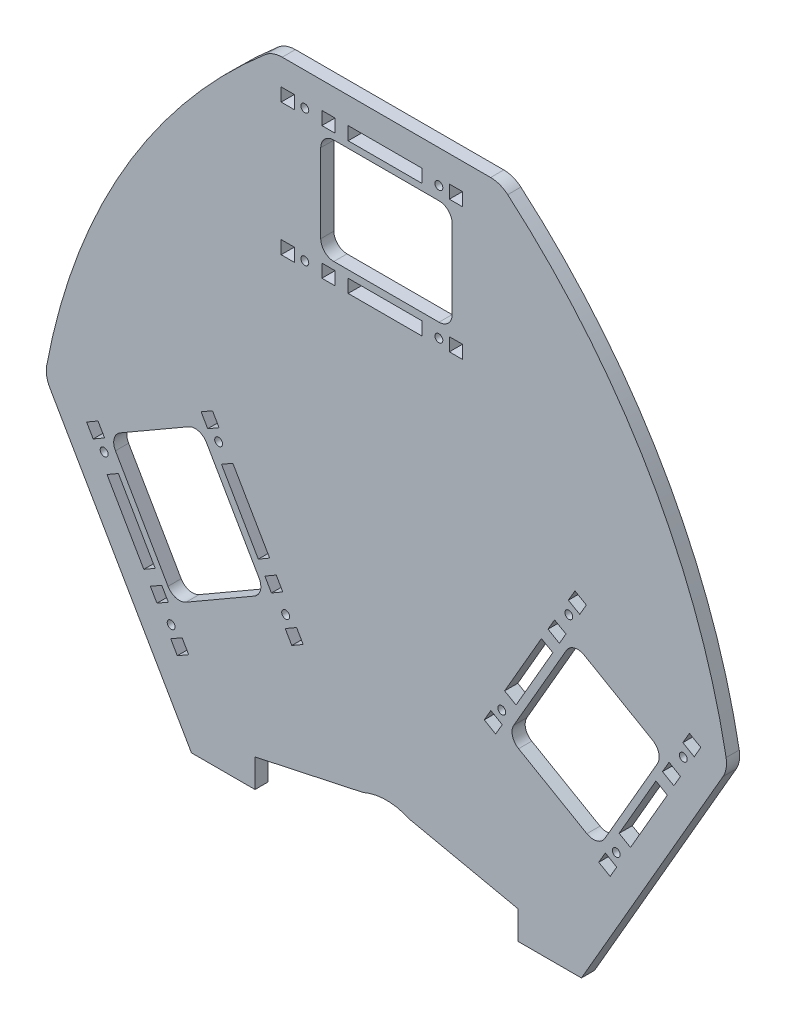
from build123d import *

# Parameters (mm, degrees)
BOSS_EXTRUDE1_DEPTH      = 5
BOSS_EXTRUDE3_DEPTH      = 5
SKETCH2_R                = 1.5
SKETCH2_W                = 50
SKETCH2_H                = 40
SKETCH2_W_2              = 5
SKETCH2_H_2              = 5
SKETCH2_W_3              = 28
CUT_EXTRUDE5_DEPTH       = 10
FILLET1_R                = 5
CIRPATTERN1_COUNT        = 3
FILLET1_OF_CIRPATTERN1_R = 5
FILLET2_R                = 10
BOSS_EXTRUDE4_DEPTH      = 5


with BuildPart() as part:
    # Sketch1 → Boss-Extrude1 (new body)
    with BuildSketch(Plane(origin=(0, 0, 0), x_dir=(0.8660254037844434, -0.49999999999999206, 0), z_dir=(0, 0, 1))):
        Polygon((125, -43.301270189), (125, 43.301270189), (-25, 129.903810568), (-100, 86.602540378), (-100, -86.602540378), (-25, -129.903810568), align=None)
    extrude(amount=BOSS_EXTRUDE1_DEPTH)

    # Sketch5 → Boss-Extrude3 (add)
    with BuildSketch(Plane.XY.offset(5)):
        with BuildLine():
            ThreePointArc((-43.301270189, 125), (-100.007931209, 57.739606004), (-129.903810568, -25))
            Line((-129.903810568, -25), (-43.301270189, 125))
        make_face()
        with BuildLine():
            ThreePointArc((129.903810568, -25), (100.007931209, 57.739606004), (43.301270189, 125))
            Line((43.301270189, 125), (129.903810568, -25))
        make_face()
    extrude(amount=-BOSS_EXTRUDE3_DEPTH)

    # Sketch2 → Cut-Extrude5 (cut)
    with BuildSketch(Plane.XY.offset(5)):
        with Locations((-31.05, 112.5)):
            Circle(SKETCH2_R)
        with Locations((-31.05, 62.1999492)):
            Circle(SKETCH2_R)
        with Locations((19.95, 112.5)):
            Circle(SKETCH2_R)
        with Locations((19.95, 62.1999492)):
            Circle(SKETCH2_R)
        with Locations((0, 87.5)):
            Rectangle(SKETCH2_W, SKETCH2_H)
        with Locations((-37.55, 112.5)):
            Rectangle(SKETCH2_W_2, SKETCH2_H_2)
        with Locations((-22.05, 112.5)):
            Rectangle(SKETCH2_W_2, SKETCH2_H_2)
        with Locations((-0.55, 112.5)):
            Rectangle(SKETCH2_W_3, SKETCH2_H_2)
        with Locations((-37.55, 62.1999492)):
            Rectangle(SKETCH2_W_2, SKETCH2_H_2)
        with Locations((-22.05, 62.1999492)):
            Rectangle(SKETCH2_W_2, SKETCH2_H_2)
        with Locations((-0.55, 62.1999492)):
            Rectangle(SKETCH2_W_3, SKETCH2_H_2)
        with Locations((26.45, 112.5)):
            Rectangle(SKETCH2_W_2, SKETCH2_H_2)
        with Locations((26.45, 62.1999492)):
            Rectangle(SKETCH2_W_2, SKETCH2_H_2)
    cut_extrude5 = extrude(amount=-CUT_EXTRUDE5_DEPTH, mode=Mode.SUBTRACT)

    # Fillet1
    fillet1_edges = [part.edges().sort_by_distance(p)[0] for p in [
        (25, 107.5, 2.5),
        (25, 67.5, 2.5),
        (-25, 67.5, 2.5),
        (-25, 107.5, 2.5),
    ]]
    fillet(fillet1_edges, radius=FILLET1_R)

    # CirPattern1: Cut-Extrude5 ×3 about axis
    cirpattern1_axis = Axis((0, 0, 0), (0, 0, -1))
    for i in range(1, CIRPATTERN1_COUNT):
        add(cut_extrude5.rotate(cirpattern1_axis, i * 360 / CIRPATTERN1_COUNT), mode=Mode.SUBTRACT)

    # Fillet1 of CirPattern1
    fillet1_of_cirpattern1_edges = [part.edges().sort_by_distance(p)[0] for p in [
        (80.597730907, -75.400635095, 2.5),
        (45.956714755, -55.400635095, 2.5),
        (70.956714755, -12.099364905, 2.5),
        (105.597730907, -32.099364905, 2.5),
        (-105.597730907, -32.099364905, 2.5),
        (-70.956714755, -12.099364905, 2.5),
        (-45.956714755, -55.400635095, 2.5),
        (-80.597730907, -75.400635095, 2.5),
    ]]
    fillet(fillet1_of_cirpattern1_edges, radius=FILLET1_OF_CIRPATTERN1_R)

    # Fillet2
    fillet2_edges = [part.edges().sort_by_distance(p)[0] for p in [
        (-129.903810568, -25, 2.5),
        (-43.301270189, 125, 2.5),
        (129.903810568, -25, 2.5),
        (86.602540378, -100, 2.5),
        (-86.602540378, -100, 2.5),
        (43.301270189, 125, 2.5),
    ]]
    fillet(fillet2_edges, radius=FILLET2_R)

    # Sketch8 → Boss-Extrude4 (add)
    with BuildSketch(Plane.XY.offset(5)):
        with BuildLine():
            Line((-50, -110.75), (-8.836531339, -101.899854238))
            ThreePointArc((-8.836531339, -101.899854238), (0, -100), (8.836531339, -101.899854238))
            Line((8.836531339, -101.899854238), (50, -110.75))
            Line((50, -110.75), (50, -121.5))
            Line((50, -121.5), (74.189509591, -121.5))
            Line((74.189509591, -121.5), (89.489291724, -95))
            Line((89.489291724, -95), (-89.489291724, -95))
            Line((-89.489291724, -95), (-74.189509591, -121.5))
            Line((-74.189509591, -121.5), (-50, -121.5))
            Line((-50, -121.5), (-50, -110.75))
        make_face()
    extrude(amount=-BOSS_EXTRUDE4_DEPTH)


solid = part.part
